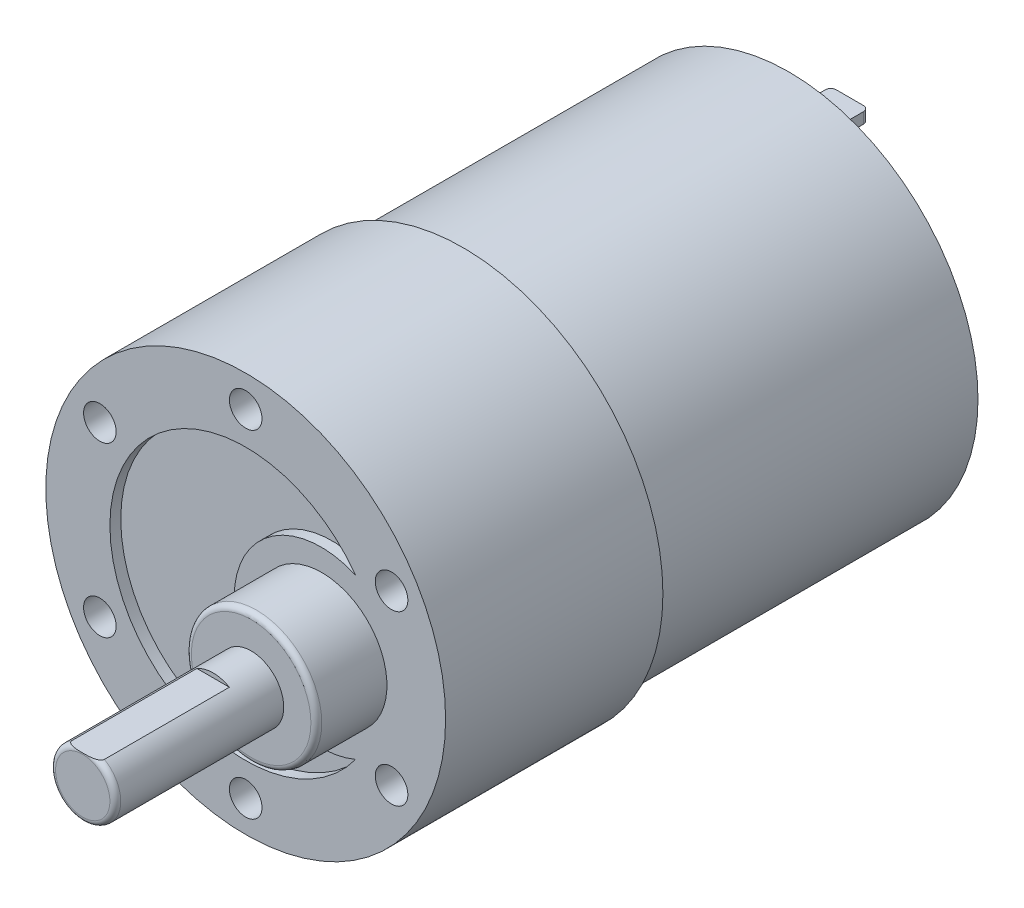
from build123d import *

# Parameters (mm, degrees)
SKETCH1_R                    = 18.4
BOSS_EXTRUDE1_DEPTH          = 20
SKETCH2_R                    = 17.4
BOSS_EXTRUDE2_DEPTH          = 30
SKETCH3_R                    = 6
BOSS_EXTRUDE3_DEPTH          = 6.5
FILLET1_R                    = 0.5
SKETCH4_R                    = 3
BOSS_EXTRUDE4_DEPTH          = 15.5
CUT_EXTRUDE1_START           = -12
CUT_EXTRUDE1_DEPTH           = 12
F_3_0_3_DIAMETER_HOLE1_D     = 3
F_3_0_3_DIAMETER_HOLE1_DEPTH = 3
F_3_0_3_DIAMETER_HOLE1_TIP   = 0.901290929
CUT_EXTRUDE2_DEPTH           = 1
SKETCH9_R                    = 4
BOSS_EXTRUDE5_DEPTH          = 1
FILLET2_R                    = 0.5
SKETCH11_W                   = 3.5
SKETCH11_H                   = 1
BOSS_EXTRUDE7_DEPTH          = 5.6
FILLET3_R                    = 0.5
SKETCH14_R                   = 1.5
BOSS_EXTRUDE9_DEPTH          = 8.55
FILLET4_R                    = 0.5


with BuildPart() as part:
    # Sketch1 → Boss-Extrude1 (new body)
    with BuildSketch(Plane.XY):
        Circle(SKETCH1_R)
    extrude(amount=BOSS_EXTRUDE1_DEPTH)

    # Sketch2 → Boss-Extrude2 (add)
    with BuildSketch(Plane(origin=(0, 0, 0), x_dir=(-1, 0, 0), z_dir=(0, 0, -1))):
        with Locations(Location((0, 0, 0), (0, 0, 180))):
            Circle(SKETCH2_R)
    extrude(amount=BOSS_EXTRUDE2_DEPTH)

    # Sketch3 → Boss-Extrude3 (add)
    with BuildSketch(Plane.XY.offset(20)):
        with Locations(Location((7, 0, 0), (0, 0, 180))):
            Circle(SKETCH3_R)
    extrude(amount=BOSS_EXTRUDE3_DEPTH)

    # Fillet1
    fillet1_edges = [part.edges().sort_by_distance(p)[0] for p in [
        (13, 0, 26.5),
    ]]
    fillet(fillet1_edges, radius=FILLET1_R)

    # Sketch4 → Boss-Extrude4 (add)
    with BuildSketch(Plane.XY.offset(26.5)):
        with Locations((7, 0)):
            Circle(SKETCH4_R)
    extrude(amount=BOSS_EXTRUDE4_DEPTH)

    # Sketch5 → Cut-Extrude1 (cut)
    with BuildSketch(Plane.XY.offset(42).offset(CUT_EXTRUDE1_START)):
        with BuildLine():
            Line((5.503337045, 2.6), (8.496662955, 2.6))
            ThreePointArc((8.496662955, 2.6), (7, 3), (5.503337045, 2.6))
        make_face()
    extrude(amount=CUT_EXTRUDE1_DEPTH, mode=Mode.SUBTRACT)

    # Ø3.0 (3) Diameter Hole1
    with Locations(Plane.XY.offset(20)):
        with Locations((-13.423393759, 7.75), (-13.423393759, -7.75), (0, -15.5), (13.423393759, 7.75), (0, 15.5), (13.423393759, -7.75)):
            Hole(F_3_0_3_DIAMETER_HOLE1_D / 2, depth=F_3_0_3_DIAMETER_HOLE1_DEPTH)
            with Locations((0, 0, -(F_3_0_3_DIAMETER_HOLE1_DEPTH + F_3_0_3_DIAMETER_HOLE1_TIP / 2))):  # 118° drill point
                Cone(0, F_3_0_3_DIAMETER_HOLE1_D / 2, F_3_0_3_DIAMETER_HOLE1_TIP, mode=Mode.SUBTRACT)

    # Sketch8 → Cut-Extrude2 (cut)
    with BuildSketch(Plane.XY.offset(20)):
        with BuildLine():
            ThreePointArc((10.116155685, 7.342574083), (-12.5, 0), (10.116155685, -7.342574083))
            ThreePointArc((10.116155685, -7.342574083), (-1.05978604, 0), (10.116155685, 7.342574083))
        make_face()
    extrude(amount=-CUT_EXTRUDE2_DEPTH, mode=Mode.SUBTRACT)

    # Sketch9 → Boss-Extrude5 (add)
    with BuildSketch(Plane(origin=(0, 0, -30), x_dir=(-1, 0, 0), z_dir=(0, 0, -1))):
        Circle(SKETCH9_R)
    extrude(amount=BOSS_EXTRUDE5_DEPTH)

    # Fillet2
    fillet2_edges = [part.edges().sort_by_distance(p)[0] for p in [
        (4, 0, -31),
    ]]
    fillet(fillet2_edges, radius=FILLET2_R)

    # Sketch11 → Boss-Extrude7 (add)
    with BuildSketch(Plane(origin=(0, 0, -30), x_dir=(-1, 0, 0), z_dir=(0, 0, -1))):
        with Locations((0, 12.05)):
            Rectangle(SKETCH11_W, SKETCH11_H)
        with Locations((0, -12.05)):
            Rectangle(SKETCH11_W, SKETCH11_H)
    extrude(amount=BOSS_EXTRUDE7_DEPTH)

    # Fillet3
    fillet3_edges = [part.edges().sort_by_distance(p)[0] for p in [
        (1.75, 12.05, -35.6),
        (-1.75, 12.05, -35.6),
        (-1.75, -12.05, -35.6),
        (1.75, -12.05, -35.6),
    ]]
    fillet(fillet3_edges, radius=FILLET3_R)

    # Sketch14 → Boss-Extrude9 (add)
    with BuildSketch(Plane(origin=(0, 0, -31), x_dir=(-1, 0, 0), z_dir=(0, 0, -1))):
        Circle(SKETCH14_R)
    extrude(amount=BOSS_EXTRUDE9_DEPTH)

    # Fillet4
    # the kernel refuses this fillet: 0.5 mm, written as the material it takes off along each edge
    with BuildSketch(Plane(origin=(7, 0, 42), x_dir=(0.4622655728594592, 0.8867415295050277, 0), z_dir=(0.8867415295050277, -0.4622655728594592, 0))) as fillet4_piece_1:
        with BuildLine():
            CenterArc((3 - FILLET4_R, -FILLET4_R), FILLET4_R, 0, 90)
            Line((3 - FILLET4_R, 0), (3 - FILLET4_R, FILLET4_R * 0.02))
            Line((3 - FILLET4_R, FILLET4_R * 0.02), (3 + FILLET4_R * 0.02, FILLET4_R * 0.02))
            Line((3 + FILLET4_R * 0.02, FILLET4_R * 0.02), (3 + FILLET4_R * 0.02, -FILLET4_R))
            Line((3 + FILLET4_R * 0.02, -FILLET4_R), (3, -FILLET4_R))
        make_face()
    revolve(axis=Axis((7, 0, 42), (0, 0, 1)), revolution_arc=297.533397677, mode=Mode.SUBTRACT)
    with BuildSketch(Plane(origin=(7, 0, 42), x_dir=(1, 0, 0), z_dir=(0, -1, 0))) as fillet4_piece_2:
        with BuildLine():
            CenterArc((3 - FILLET4_R, -FILLET4_R), FILLET4_R, 0, 90)
            Line((3 - FILLET4_R, 0), (3 - FILLET4_R, FILLET4_R * 0.02))
            Line((3 - FILLET4_R, FILLET4_R * 0.02), (3 + FILLET4_R * 0.02, FILLET4_R * 0.02))
            Line((3 + FILLET4_R * 0.02, FILLET4_R * 0.02), (3 + FILLET4_R * 0.02, -FILLET4_R))
            Line((3 + FILLET4_R * 0.02, -FILLET4_R), (3, -FILLET4_R))
        make_face()
    revolve(axis=Axis((7, 0, 42), (0, 0, 1)), revolution_arc=117.379597562, mode=Mode.SUBTRACT)


solid = part.part
